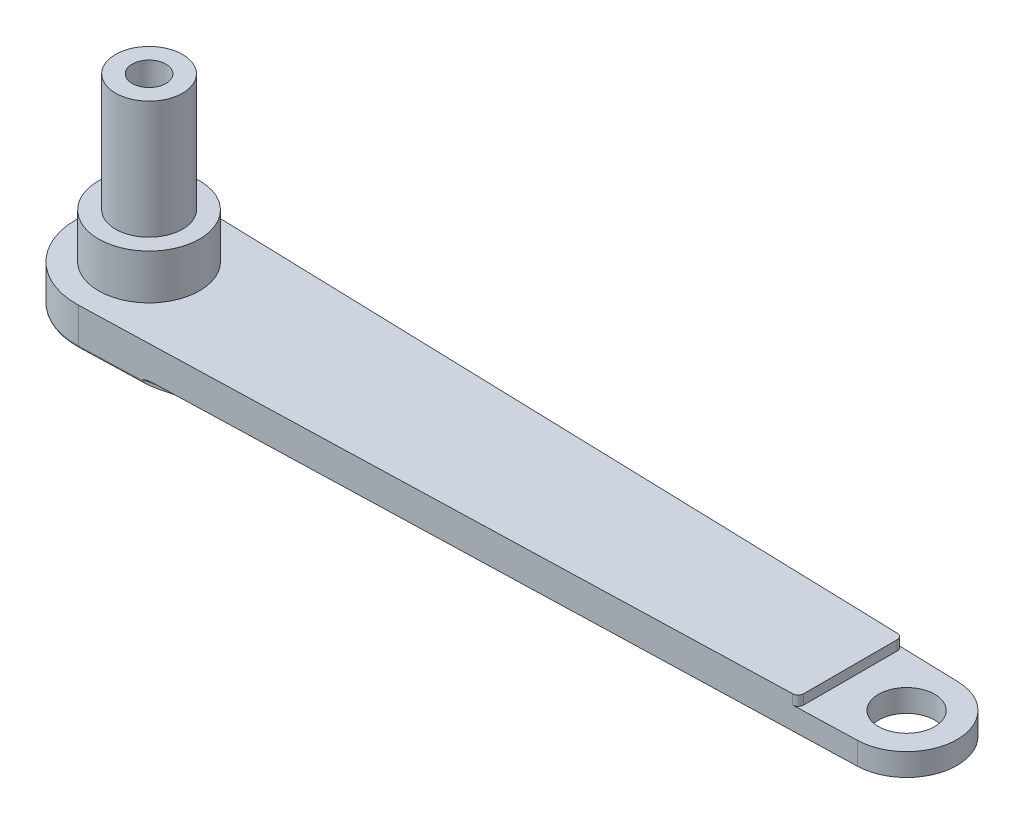
from build123d import *

# Parameters (mm, degrees)
SKETCH2_R           = 5
BOSS_EXTRUDE1_DEPTH = 6.75
SKETCH4_R           = 5.975
BOSS_EXTRUDE3_DEPTH = 29
CUT_EXTRUDE2_DEPTH  = 1.75
FILLET1_R           = 1
SKETCH7_R           = 9
BOSS_EXTRUDE4_DEPTH = 8
SKETCH5_R           = 3
CUT_EXTRUDE1_DEPTH  = 126.970361132
SKETCH8_R           = 3
CUT_EXTRUDE3_DEPTH  = 5
CUT_EXTRUDE4_DEPTH  = 1
BOSS_EXTRUDE5_START = 0.5
BOSS_EXTRUDE5_DEPTH = 0.5
SKETCH11_R          = 3
SKETCH11_R_2        = 1.75
BOSS_EXTRUDE6_DEPTH = 1.75
FILLET2_R           = 0.5
FILLET3_R           = 0.5


with BuildPart() as part:
    # Sketch2 → Boss-Extrude1 (new body)
    with BuildSketch(Plane(origin=(0, 0, 0), x_dir=(1, 0, 0), z_dir=(0, 1, 0))):
        with BuildLine():
            Line((-23.525392368, 12.9942923), (111.356089114, 8.996048515))
            ThreePointArc((111.356089114, 8.996048515), (120.089422447, 0), (111.356089114, -8.996048515))
            Line((111.356089114, -8.996048515), (-23.525392368, -12.9942923))
            ThreePointArc((-23.525392368, -12.9942923), (-36.910577553, 0), (-23.525392368, 12.9942923))
        make_face()
        with Locations((111.089422447, 0)):
            Circle(SKETCH2_R, mode=Mode.SUBTRACT)
    extrude(amount=BOSS_EXTRUDE1_DEPTH)

    # Sketch4 → Boss-Extrude3 (add)
    with BuildSketch(Plane(origin=(0, 6.75, 0), x_dir=(1, 0, 0), z_dir=(0, 1, 0))):
        with Locations((-23.910577553, 0)):
            Circle(SKETCH4_R)
    extrude(amount=BOSS_EXTRUDE3_DEPTH)

    # Sketch6 → Cut-Extrude2 (cut)
    with BuildSketch(Plane(origin=(0, 6.75, 0), x_dir=(1, 0, 0), z_dir=(0, 1, 0))):
        Polygon((101.089422447, 0), (101.089422447, 15.957712546), (123.696181887, 15.957712546), (123.696181887, -15.662199351), (101.089422447, -15.662199351), align=None)
    extrude(amount=-CUT_EXTRUDE2_DEPTH, mode=Mode.SUBTRACT)

    # Fillet1
    fillet1_edges = [part.edges().sort_by_distance(p)[0] for p in [
        (101.089422447, 5.875, -9.300379664),
        (101.089422447, 5.875, 9.300379664),
    ]]
    fillet(fillet1_edges, radius=FILLET1_R)

    # Sketch7 → Boss-Extrude4 (add)
    with BuildSketch(Plane(origin=(0, 6.75, 0), x_dir=(1, 0, 0), z_dir=(0, 1, 0))):
        with Locations((-23.910577553, 0)):
            Circle(SKETCH7_R)
    extrude(amount=BOSS_EXTRUDE4_DEPTH)

    # Sketch5 → Cut-Extrude1 (cut, through all)
    with BuildSketch(Plane.XZ):
        with Locations((-23.910577553, 0)):
            Circle(SKETCH5_R)
    extrude(amount=-CUT_EXTRUDE1_DEPTH, mode=Mode.SUBTRACT)

    # Sketch8 → Cut-Extrude3 (cut)
    with BuildSketch(Plane.XZ):
        with BuildLine():
            ThreePointArc((-23.910577553, 6.625), (-30.535577553, 0), (-23.910577553, -6.625))
            Line((-23.910577553, -6.625), (6.546625051, -4.236996747))
            ThreePointArc((6.546625051, -4.236996747), (10.464422447, 0), (6.546625051, 4.236996747))
            Line((6.546625051, 4.236996747), (-23.910577553, 6.625))
        make_face()
        with Locations((-23.910577553, 0)):
            Circle(SKETCH8_R, mode=Mode.SUBTRACT)
    extrude(amount=-CUT_EXTRUDE3_DEPTH, mode=Mode.SUBTRACT)

    # Sketch9 → Cut-Extrude4 (cut)
    with BuildSketch(Plane.XZ):
        with BuildLine():
            Line((-12.452129788, 12.666051515), (77.547870212, 9.998213524))
            ThreePointArc((77.547870212, 9.998213524), (146.089422447, 0), (77.547870212, -9.998213524))
            Line((77.547870212, -9.998213524), (-12.452129788, 12.666051515))
        make_face()
    extrude(amount=-CUT_EXTRUDE4_DEPTH, mode=Mode.SUBTRACT)

    # Sketch10 → Boss-Extrude5 (add)
    with BuildSketch(Plane.XZ.offset(-5).offset(BOSS_EXTRUDE5_START)):
        with BuildLine():
            Line((-8.681976251, 5.430998373), (6.546625051, 4.236996747))
            ThreePointArc((6.546625051, 4.236996747), (10.464422447, 0), (6.546625051, -4.236996747))
            Line((6.546625051, -4.236996747), (-8.681976251, -5.430998373))
            Line((-8.681976251, -5.430998373), (-13.666678305, -5.821824966))
            Line((-13.666678305, -5.821824966), (-13.666678305, 5.821824966))
            Line((-13.666678305, 5.821824966), (-8.681976251, 5.430998373))
        make_face()
    extrude(amount=-BOSS_EXTRUDE5_DEPTH)

    # Sketch11 → Boss-Extrude6 (add)
    with BuildSketch(Plane.XZ.offset(-5)):
        with Locations((-23.910577553, 0)):
            Circle(SKETCH11_R)
        with Locations((-23.910577553, 0)):
            Circle(SKETCH11_R_2, mode=Mode.SUBTRACT)
    extrude(amount=-BOSS_EXTRUDE6_DEPTH)

    # Fillet2
    fillet2_edges = [part.edges().sort_by_distance(p)[0] for p in [
        (32.547870212, 1, 1.333918996),
    ]]
    fillet(fillet2_edges, radius=FILLET2_R)

    # Fillet3
    fillet3_edges = [part.edges().sort_by_distance(p)[0] for p in [
        (-17.988761078, 0, 12.830171908),
        (-36.910577553, 0, 0),
        (27.011238922, 0, -11.496252912),
    ]]
    fillet(fillet3_edges, radius=FILLET3_R)


solid = part.part
